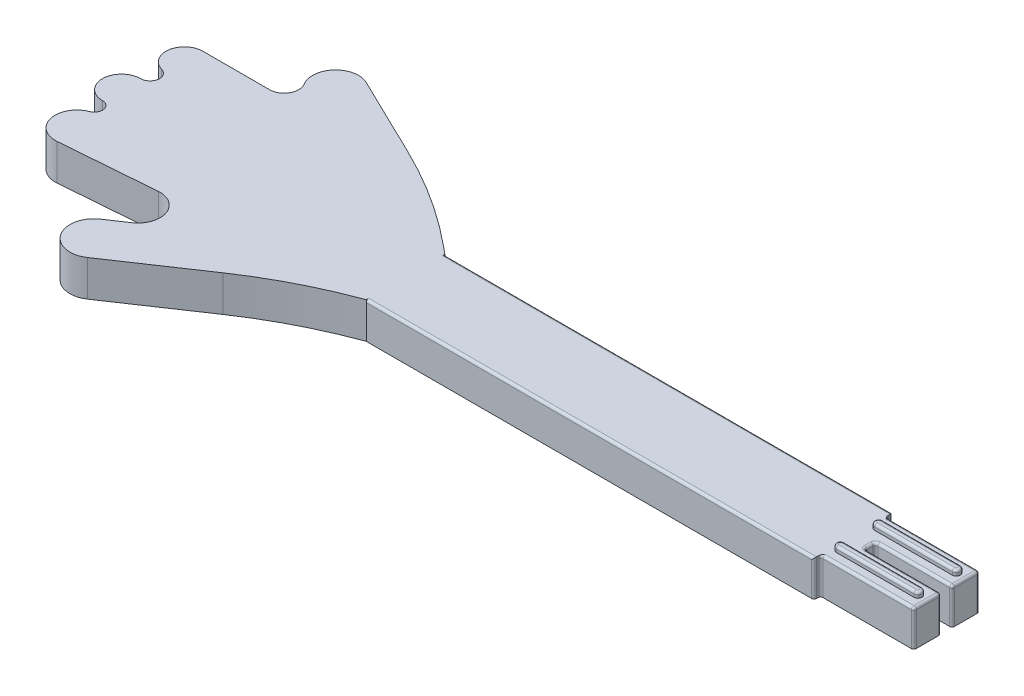
from build123d import *

# Parameters (mm, degrees)
BOSS_EXTRUDE1_DEPTH = 7.25
BOSS_EXTRUDE2_DEPTH = 1.1
FILLET1_R           = 0.5
SKETCH4_W           = 90
SKETCH4_H           = 15.8
BOSS_EXTRUDE3_DEPTH = 7.25
FILLET3_R           = 0.5
BOSS_EXTRUDE4_DEPTH = 7.25


with BuildPart() as part:
    # Sketch1 → Boss-Extrude1 (new body)
    with BuildSketch(Plane(origin=(0, 0, 0), x_dir=(1, 0, 0), z_dir=(0, 1, 0))):
        with BuildLine():
            Line((0, 0), (18.25, 0))
            ThreePointArc((18.25, 0), (18.603553391, 0.146446609), (18.75, 0.5))
            Line((18.75, 0.5), (18.75, 5))
            ThreePointArc((18.75, 5), (18.603553391, 5.353553391), (18.25, 5.5))
            Line((18.25, 5.5), (3.85, 5.5))
            ThreePointArc((3.85, 5.5), (3.496446609, 5.646446609), (3.35, 6))
            Line((3.35, 6), (3.35, 7.2))
            ThreePointArc((3.35, 7.2), (3.496446609, 7.553553391), (3.85, 7.7))
            Line((3.85, 7.7), (18.25, 7.7))
            ThreePointArc((18.25, 7.7), (18.603553391, 7.846446609), (18.75, 8.2))
            Line((18.75, 8.2), (18.75, 12.7))
            ThreePointArc((18.75, 12.7), (18.603553391, 13.053553391), (18.25, 13.2))
            Line((18.25, 13.2), (0, 13.2))
            Line((0, 13.2), (0, 0))
        make_face()
    extrude(amount=BOSS_EXTRUDE1_DEPTH)

    # Sketch2 → Boss-Extrude2 (add)
    with BuildSketch(Plane(origin=(0, 7.25, 0), x_dir=(1, 0, 0), z_dir=(0, 1, 0))):
        with BuildLine():
            Line((1.25, 3.55), (16.85, 3.55))
            ThreePointArc((16.85, 3.55), (17.65, 2.75), (16.85, 1.95))
            Line((16.85, 1.95), (1.25, 1.95))
            ThreePointArc((1.25, 1.95), (0.45, 2.75), (1.25, 3.55))
        make_face()
        with BuildLine():
            Line((1.25, 9.65), (16.85, 9.65))
            ThreePointArc((16.85, 9.65), (17.65, 10.45), (16.85, 11.25))
            Line((16.85, 11.25), (1.25, 11.25))
            ThreePointArc((1.25, 11.25), (0.45, 10.45), (1.25, 9.65))
        make_face()
    extrude(amount=BOSS_EXTRUDE2_DEPTH)

    # Fillet1
    fillet1_edges = [part.edges().sort_by_distance(p)[0] for p in [
        (18.603553391, 7.25, -0.146446609),
        (18.75, 7.25, -2.75),
        (18.603553391, 7.25, -5.353553391),
        (11.05, 7.25, -5.5),
        (3.496446609, 7.25, -5.646446609),
        (3.35, 7.25, -6.6),
        (3.496446609, 7.25, -7.553553391),
        (11.05, 7.25, -7.7),
        (18.603553391, 7.25, -7.846446609),
        (0.45, 8.35, -2.75),
        (9.05, 8.35, -1.95),
        (17.65, 8.35, -2.75),
        (9.05, 8.35, -3.55),
        (18.75, 7.25, -10.45),
        (18.603553391, 7.25, -13.053553391),
        (9.125, 7.25, -13.2),
        (0.45, 8.35, -10.45),
        (9.05, 8.35, -9.65),
        (17.65, 8.35, -10.45),
        (9.05, 8.35, -11.25),
        (9.125, 7.25, 0),
    ]]
    fillet(fillet1_edges, radius=FILLET1_R)

    # Sketch4 → Boss-Extrude3 (add)
    with BuildSketch(Plane(origin=(0, 0, 0), x_dir=(1, 0, 0), z_dir=(0, 1, 0))):
        with Locations((-45, 6.6)):
            Rectangle(SKETCH4_W, SKETCH4_H)
    extrude(amount=BOSS_EXTRUDE3_DEPTH)

    # Fillet3
    # the kernel refuses this fillet: 0.5 mm, written as the material it adds along each edge
    with BuildSketch(Plane(origin=(0, 0, 0), x_dir=(0, 0, 1), z_dir=(0, 1, 0))) as fillet3_piece_1:
        with BuildLine():
            CenterArc((FILLET3_R, FILLET3_R), FILLET3_R, 180, 90)
            Line((0, FILLET3_R), (0, 0))
            Line((0, 0), (FILLET3_R, 0))
        make_face()
    extrude(amount=6.75)
    with BuildSketch(Plane(origin=(0, 0, -13.2), x_dir=(0, 0, -1), z_dir=(0, 1, 0))) as fillet3_piece_2:
        with BuildLine():
            CenterArc((FILLET3_R, -FILLET3_R), FILLET3_R, 90, 90)
            Line((0, -FILLET3_R), (0, 0))
            Line((0, 0), (FILLET3_R, 0))
        make_face()
    extrude(amount=6.75)
    with BuildSketch(Plane(origin=(0, 6.75, -12.7), x_dir=(0, -0.8017442392976486, 0.5976672776328271), z_dir=(0, -0.5976672776328271, -0.8017442392976486))) as fillet3_piece_3_section:
        with BuildLine():
            CenterArc((0.5 + FILLET3_R, -FILLET3_R), FILLET3_R, 90, 90)
            Line((0.5, -FILLET3_R), (0.5, 0))
            Line((0.5, 0), (0.5 + FILLET3_R, 0))
        make_face()
    fillet3_piece_3 = revolve(axis=Axis((0, 6.75, -12.7), (-1, 0, 0)), revolution_arc=233.296989237, mode=Mode.PRIVATE)
    fillet3_piece_3 = split(fillet3_piece_3, bisect_by=Plane(origin=(0.15581414, 7.25, -13.074969472), z_dir=(0, -1, 0)), keep=Keep.TOP, mode=Mode.PRIVATE)
    add(fillet3_piece_3)
    with BuildSketch(Plane(origin=(0, 6.75, -0.5), x_dir=(0, -0.801744239297648, -0.5976672776328278), z_dir=(0, -0.5976672776328278, 0.801744239297648))) as fillet3_piece_4_section:
        with BuildLine():
            CenterArc((0.5 + FILLET3_R, FILLET3_R), FILLET3_R, 180, 90)
            Line((0.5, FILLET3_R), (0.5, 0))
            Line((0.5, 0), (0.5 + FILLET3_R, 0))
        make_face()
    fillet3_piece_4 = revolve(axis=Axis((0, 6.75, -0.5), (1, 0, 0)), revolution_arc=233.296989237, mode=Mode.PRIVATE)
    fillet3_piece_4 = split(fillet3_piece_4, bisect_by=Plane(origin=(0.155814151, 7.25, -0.125030527), z_dir=(0, -1, 0)), keep=Keep.TOP, mode=Mode.PRIVATE)
    add(fillet3_piece_4)
    # the kernel refuses this fillet: 0.5 mm, written as the material it takes off along each edge
    with BuildSketch(Plane(origin=(0, -1.25, 1.3), x_dir=(0, 0, -1), z_dir=(0, 1, 0))) as fillet3_2_piece_1:
        with BuildLine():
            CenterArc((FILLET3_R, FILLET3_R), FILLET3_R, 180, 90)
            Line((0, FILLET3_R), (0, 0))
            Line((0, 0), (FILLET3_R, 0))
        make_face()
    extrude(amount=9.75, mode=Mode.SUBTRACT)
    with BuildSketch(Plane(origin=(0, -1.25, -14.5), x_dir=(0, 0, 1), z_dir=(0, 1, 0))) as fillet3_2_piece_2:
        with BuildLine():
            CenterArc((FILLET3_R, -FILLET3_R), FILLET3_R, 90, 90)
            Line((0, -FILLET3_R), (0, 0))
            Line((0, 0), (FILLET3_R, 0))
        make_face()
    extrude(amount=9.75, mode=Mode.SUBTRACT)
    with BuildSketch(Plane(origin=(-91.25, 7.25, 1.3), x_dir=(0, 0, -1), z_dir=(1, 0, 0)), Plane(origin=(1.25, 7.25, -14.5), x_dir=(0, 0, 1), z_dir=(-1, 0, 0))) as fillet3_2_piece_3:
        with BuildLine():
            CenterArc((FILLET3_R, -FILLET3_R), FILLET3_R, 90, 90)
            Line((0, -FILLET3_R), (0, 0))
            Line((0, 0), (FILLET3_R, 0))
        make_face()
    extrude(amount=92.5, mode=Mode.SUBTRACT)

    # Sketch5 → Boss-Extrude4 (add)
    with BuildSketch(Plane(origin=(0, 7.25, 0), x_dir=(1, 0, 0), z_dir=(0, 1, 0))):
        with BuildLine():
            Line((-90, 14.5), (-91.694558873, 15.893887447))
            ThreePointArc((-91.694558873, 15.893887447), (-101.255273326, 22.85289034), (-111.570616913, 28.634643431))
            Line((-111.570616913, 28.634643431), (-127.809202797, 36.513023717))
            ThreePointArc((-127.809202797, 36.513023717), (-133.229461338, 35.472077659), (-133.770408027, 29.979341726))
            ThreePointArc((-133.770408027, 29.979341726), (-133.726831866, 27.027184623), (-136.276459546, 25.538383383))
            Line((-136.276459546, 25.538383383), (-149.666955308, 25.538383383))
            ThreePointArc((-149.666955308, 25.538383383), (-153.346325023, 22.325436822), (-150.658389652, 18.246737208))
            ThreePointArc((-150.658389652, 18.246737208), (-149.277221775, 16.150939464), (-151.167827967, 14.5))
            ThreePointArc((-151.167827967, 14.5), (-154.994699417, 10.67312855), (-151.167827967, 6.8462571))
            ThreePointArc((-151.167827967, 6.8462571), (-149.535956381, 5.487012057), (-150.577779387, 3.636294146))
            ThreePointArc((-150.577779387, 3.636294146), (-153.292773274, -1.415823247), (-148.677747615, -4.821204301))
            Line((-148.677747615, -4.821204301), (-129.766646687, -3.335569849))
            ThreePointArc((-129.766646687, -3.335569849), (-125.233182835, -6.296372519), (-126.944947273, -11.433347257))
            Line((-126.944947273, -11.433347257), (-130.743308987, -13.988655394))
            ThreePointArc((-130.743308987, -13.988655394), (-132.049672504, -20.665923892), (-125.372404006, -21.97228741))
            Line((-125.372404006, -21.97228741), (-109.093123035, -11.020571314))
            ThreePointArc((-109.093123035, -11.020571314), (-99.841658682, -5.580656509), (-90, -1.3))
            Line((-90, -1.3), (-90, 14.5))
        make_face()
    extrude(amount=-BOSS_EXTRUDE4_DEPTH)


solid = part.part
